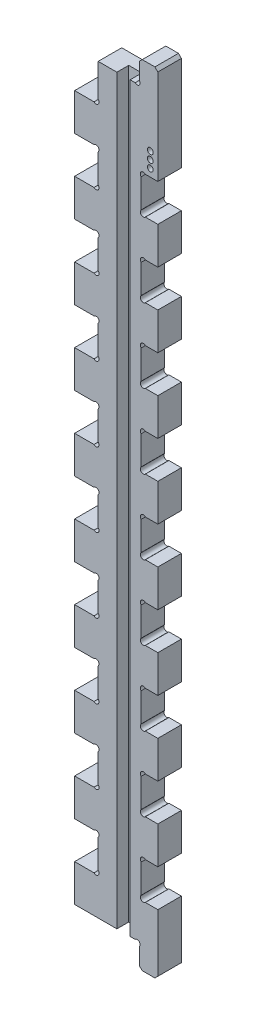
from build123d import *

# Parameters (mm, degrees)
BOSS_EXTRUDE1_DEPTH = 6.35
CHAMFER1_SIZE       = 0.79375
SKETCH16_W          = 3.558466008
SKETCH16_H          = 3.18996611
CUT_EXTRUDE14_DEPTH = 208.663320883
SKETCH21_R          = 0.79375
CUT_EXTRUDE16_DEPTH = 3.175
LPATTERN3_COUNT     = 3
LPATTERN3_PITCH     = 2.032


# Read off the part's stored shape, not the designer's step: Boss-Extrude1
with BuildPart() as part:
    # Boss-Extrude1 outline → Boss-Extrude1 (new body)
    with BuildSketch(Plane.XY):
        with BuildLine():
            Line((22.436796564, 150), (19.069200519, 150))
            ThreePointArc((19.069200519, 150), (17.946668504, 150), (17.946668504, 151.122532015))
            Line((17.946668504, 151.122532015), (17.946668504, 158.877467985))
            ThreePointArc((17.946668504, 158.877467985), (17.946668504, 160), (19.069200519, 160))
            Line((19.069200519, 160), (22.436796564, 160))
            Line((22.436796564, 160), (22.436796564, 170))
            Line((22.436796564, 170), (19.069200519, 170))
            ThreePointArc((19.069200519, 170), (17.946668504, 170), (17.946668504, 171.122532015))
            Line((17.946668504, 171.122532015), (17.946668504, 178.877467985))
            ThreePointArc((17.946668504, 178.877467985), (17.946668504, 180), (19.069200519, 180))
            Line((19.069200519, 180), (22.436796564, 180))
            Line((22.436796564, 180), (22.436796564, 206.35))
            Line((22.436796564, 206.35), (17.436796564, 206.35))
            Line((17.436796564, 206.35), (17.436796564, 201.122532015))
            ThreePointArc((17.436796564, 201.122532015), (17.436796564, 200), (16.314264549, 200))
            Line((16.314264549, 200), (6.35, 200))
            Line((6.35, 200), (6.35, 191.122532015))
            ThreePointArc((6.35, 191.122532015), (6.35, 190), (5.227467985, 190))
            Line((5.227467985, 190), (0, 190))
            Line((0, 190), (0, 180))
            Line((0, 180), (5.227467985, 180))
            ThreePointArc((5.227467985, 180), (6.35, 180), (6.35, 178.877467985))
            Line((6.35, 178.877467985), (6.35, 171.122532015))
            ThreePointArc((6.35, 171.122532015), (6.35, 170), (5.227467985, 170))
            Line((5.227467985, 170), (0, 170))
            Line((0, 170), (0, 160))
            Line((0, 160), (5.227467985, 160))
            ThreePointArc((5.227467985, 160), (6.35, 160), (6.35, 158.877467985))
            Line((6.35, 158.877467985), (6.35, 151.122532015))
            ThreePointArc((6.35, 151.122532015), (6.35, 150), (5.227467985, 150))
            Line((5.227467985, 150), (0, 150))
            Line((0, 150), (0, 140))
            Line((0, 140), (5.227467985, 140))
            ThreePointArc((5.227467985, 140), (6.35, 140), (6.35, 138.877467985))
            Line((6.35, 138.877467985), (6.35, 131.122532015))
            ThreePointArc((6.35, 131.122532015), (6.35, 130), (5.227467985, 130))
            Line((5.227467985, 130), (0, 130))
            Line((0, 130), (0, 120))
            Line((0, 120), (5.227467985, 120))
            ThreePointArc((5.227467985, 120), (6.35, 120), (6.35, 118.877467985))
            Line((6.35, 118.877467985), (6.35, 111.122532015))
            ThreePointArc((6.35, 111.122532015), (6.35, 110), (5.227467985, 110))
            Line((5.227467985, 110), (0, 110))
            Line((0, 110), (0, 100))
            Line((0, 100), (5.227467985, 100))
            ThreePointArc((5.227467985, 100), (6.35, 100), (6.35, 98.877467985))
            Line((6.35, 98.877467985), (6.35, 91.122532015))
            ThreePointArc((6.35, 91.122532015), (6.35, 90), (5.227467985, 90))
            Line((5.227467985, 90), (0, 90))
            Line((0, 90), (0, 80))
            Line((0, 80), (5.227467985, 80))
            ThreePointArc((5.227467985, 80), (6.35, 80), (6.35, 78.877467985))
            Line((6.35, 78.877467985), (6.35, 71.122532015))
            ThreePointArc((6.35, 71.122532015), (6.35, 70), (5.227467985, 70))
            Line((5.227467985, 70), (0, 70))
            Line((0, 70), (0, 60))
            Line((0, 60), (5.227467985, 60))
            ThreePointArc((5.227467985, 60), (6.35, 60), (6.35, 58.877467985))
            Line((6.35, 58.877467985), (6.35, 51.122532015))
            ThreePointArc((6.35, 51.122532015), (6.35, 50), (5.227467985, 50))
            Line((5.227467985, 50), (0, 50))
            Line((0, 50), (0, 40))
            Line((0, 40), (5.227467985, 40))
            ThreePointArc((5.227467985, 40), (6.35, 40), (6.35, 38.877467985))
            Line((6.35, 38.877467985), (6.35, 31.122532015))
            ThreePointArc((6.35, 31.122532015), (6.35, 30), (5.227467985, 30))
            Line((5.227467985, 30), (0, 30))
            Line((0, 30), (0, 20))
            Line((0, 20), (5.227467985, 20))
            ThreePointArc((5.227467985, 20), (6.35, 20), (6.35, 18.877467985))
            Line((6.35, 18.877467985), (6.35, 11.122532015))
            ThreePointArc((6.35, 11.122532015), (6.35, 10), (5.227467985, 10))
            Line((5.227467985, 10), (0, 10))
            Line((0, 10), (0, 0))
            Line((0, 0), (16.314264549, 0))
            ThreePointArc((16.314264549, 0), (17.436796564, 0), (17.436796564, -1.122532015))
            Line((17.436796564, -1.122532015), (17.436796564, -6.35))
            Line((17.436796564, -6.35), (22.436796564, -6.35))
            Line((22.436796564, -6.35), (22.436796564, 10))
            Line((22.436796564, 10), (19.069200519, 10))
            ThreePointArc((19.069200519, 10), (17.946668504, 10), (17.946668504, 11.122532015))
            Line((17.946668504, 11.122532015), (17.946668504, 18.877467985))
            ThreePointArc((17.946668504, 18.877467985), (17.946668504, 20), (19.069200519, 20))
            Line((19.069200519, 20), (22.436796564, 20))
            Line((22.436796564, 20), (22.436796564, 30))
            Line((22.436796564, 30), (19.069200519, 30))
            ThreePointArc((19.069200519, 30), (17.946668504, 30), (17.946668504, 31.122532015))
            Line((17.946668504, 31.122532015), (17.946668504, 38.877467985))
            ThreePointArc((17.946668504, 38.877467985), (17.946668504, 40), (19.069200519, 40))
            Line((19.069200519, 40), (22.436796564, 40))
            Line((22.436796564, 40), (22.436796564, 50))
            Line((22.436796564, 50), (19.069200519, 50))
            ThreePointArc((19.069200519, 50), (17.946668504, 50), (17.946668504, 51.122532015))
            Line((17.946668504, 51.122532015), (17.946668504, 58.877467985))
            ThreePointArc((17.946668504, 58.877467985), (17.946668504, 60), (19.069200519, 60))
            Line((19.069200519, 60), (22.436796564, 60))
            Line((22.436796564, 60), (22.436796564, 70))
            Line((22.436796564, 70), (19.069200519, 70))
            ThreePointArc((19.069200519, 70), (17.946668504, 70), (17.946668504, 71.122532015))
            Line((17.946668504, 71.122532015), (17.946668504, 78.877467985))
            ThreePointArc((17.946668504, 78.877467985), (17.946668504, 80), (19.069200519, 80))
            Line((19.069200519, 80), (22.436796564, 80))
            Line((22.436796564, 80), (22.436796564, 90))
            Line((22.436796564, 90), (19.069200519, 90))
            ThreePointArc((19.069200519, 90), (17.946668504, 90), (17.946668504, 91.122532015))
            Line((17.946668504, 91.122532015), (17.946668504, 98.877467985))
            ThreePointArc((17.946668504, 98.877467985), (17.946668504, 100), (19.069200519, 100))
            Line((19.069200519, 100), (22.436796564, 100))
            Line((22.436796564, 100), (22.436796564, 110))
            Line((22.436796564, 110), (19.069200519, 110))
            ThreePointArc((19.069200519, 110), (17.946668504, 110), (17.946668504, 111.122532015))
            Line((17.946668504, 111.122532015), (17.946668504, 118.877467985))
            ThreePointArc((17.946668504, 118.877467985), (17.946668504, 120), (19.069200519, 120))
            Line((19.069200519, 120), (22.436796564, 120))
            Line((22.436796564, 120), (22.436796564, 130))
            Line((22.436796564, 130), (19.069200519, 130))
            ThreePointArc((19.069200519, 130), (17.946668504, 130), (17.946668504, 131.122532015))
            Line((17.946668504, 131.122532015), (17.946668504, 138.877467985))
            ThreePointArc((17.946668504, 138.877467985), (17.946668504, 140), (19.069200519, 140))
            Line((19.069200519, 140), (22.436796564, 140))
            Line((22.436796564, 140), (22.436796564, 150))
        make_face()
    extrude(amount=BOSS_EXTRUDE1_DEPTH)

    # Chamfer1
    chamfer1_edges = [part.edges().sort_by_distance(p)[0] for p in [
        (22.436796564, -6.35, 3.175),
        (17.436796564, -6.35, 3.175),
        (17.436796564, 206.35, 3.175),
        (22.436796564, 206.35, 3.175),
    ]]
    chamfer(chamfer1_edges, length=CHAMFER1_SIZE)

    # Sketch16 → Cut-Extrude14 (cut, through all)
    with BuildSketch(Plane.XZ):
        with Locations((13.17971111, 4.755016945)):
            Rectangle(SKETCH16_W, SKETCH16_H)
    extrude(amount=-CUT_EXTRUDE14_DEPTH, mode=Mode.SUBTRACT)

    # Sketch21 → Cut-Extrude16 (cut)
    with BuildSketch(Plane.XY.offset(6.35)):
        with Locations((20.404796564, 182.032)):
            Circle(SKETCH21_R)
    cut_extrude16 = extrude(amount=-CUT_EXTRUDE16_DEPTH, mode=Mode.SUBTRACT)

    # LPattern3: Cut-Extrude16 ×3
    with Locations(*[(0, i * LPATTERN3_PITCH, 0) for i in range(1, LPATTERN3_COUNT)]):
        add(cut_extrude16, mode=Mode.SUBTRACT)


solid = part.part
